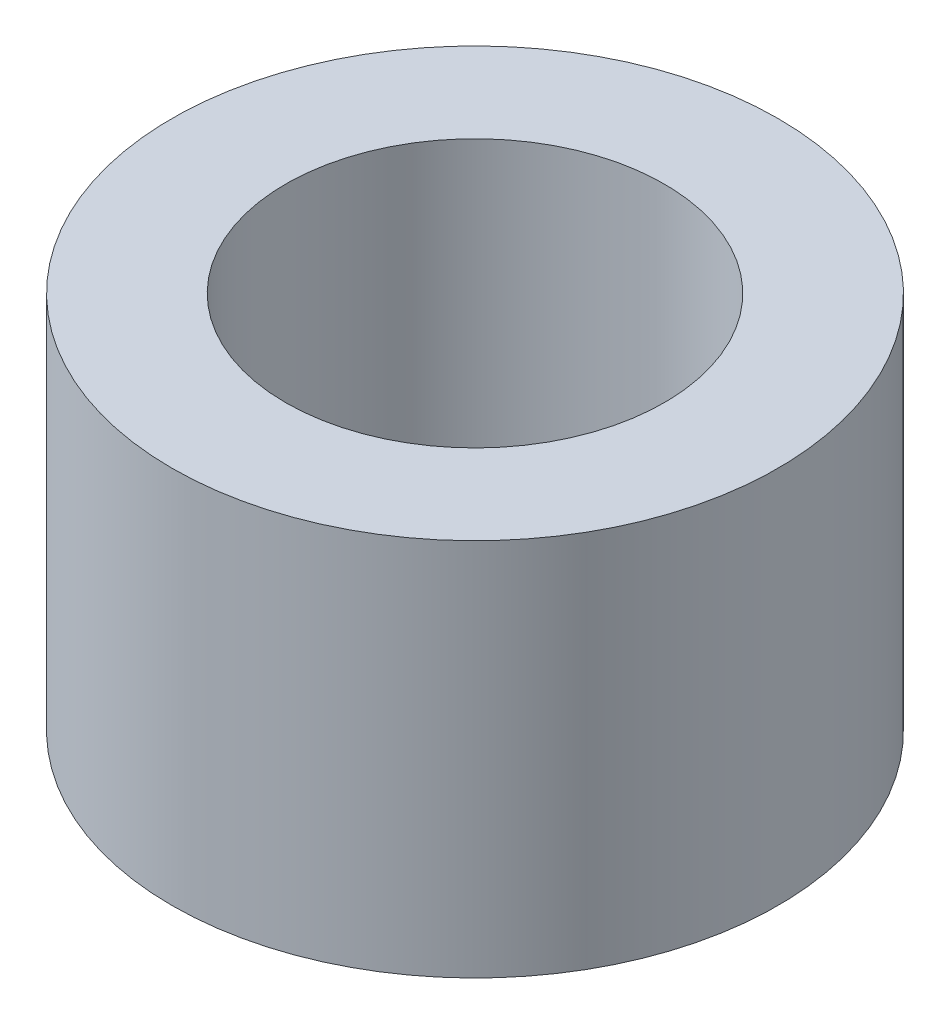
from build123d import *

# Parameters (mm, degrees)
SKETCH2_R           = 4
SKETCH2_R_2         = 2.5
BOSS_EXTRUDE1_DEPTH = 5


with BuildPart() as part:
    # Sketch2 → Boss-Extrude1 (new body)
    with BuildSketch(Plane(origin=(0, 0, 0), x_dir=(1, 0, 0), z_dir=(0, 1, 0))):
        Circle(SKETCH2_R)
        Circle(SKETCH2_R_2, mode=Mode.SUBTRACT)
    extrude(amount=BOSS_EXTRUDE1_DEPTH)


solid = part.part
